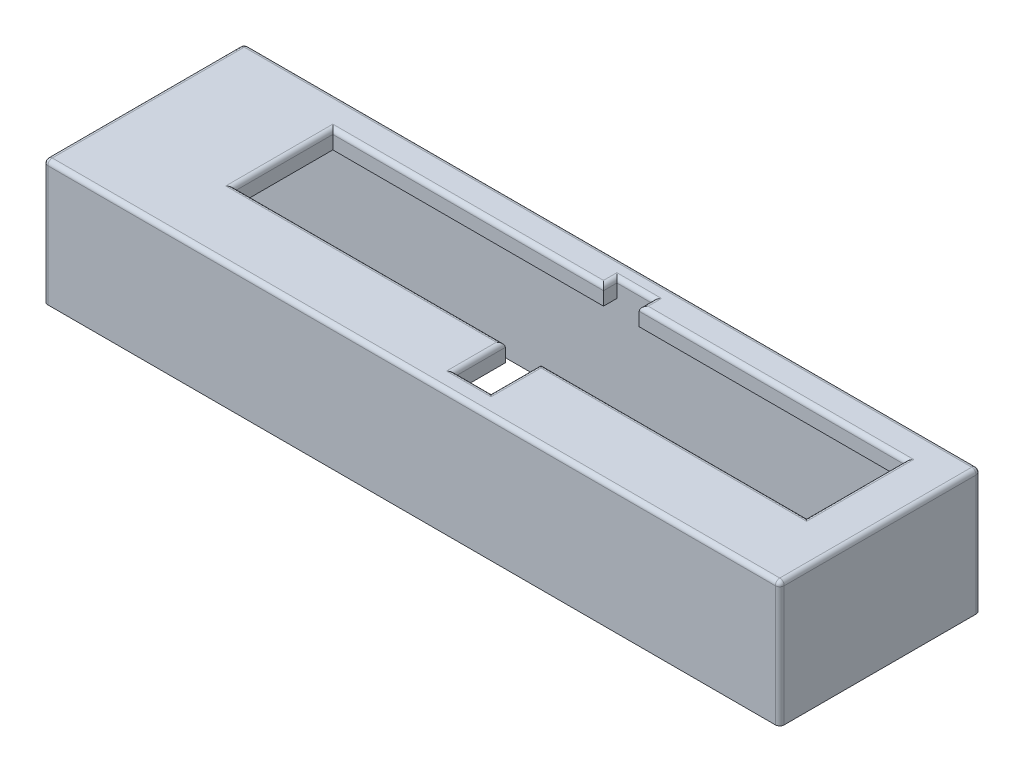
from build123d import *

# Parameters (mm, degrees)
SKETCH1_W           = 209.55
SKETCH1_H           = 57.15
BOSS_EXTRUDE1_DEPTH = 5.08
SKETCH2_W           = 209.55
SKETCH2_H           = 57.15
SKETCH2_W_2         = 199.39
SKETCH2_H_2         = 46.99
BOSS_EXTRUDE2_DEPTH = 30.48
CUT_EXTRUDE2_REACH  = 117.837
FILLET1_R           = 1.27


with BuildPart() as part:
    # Sketch1 → Boss-Extrude1 (new body)
    with BuildSketch(Plane(origin=(0, 0, 0), x_dir=(1, 0, 0), z_dir=(0, 1, 0))):
        with Locations((0, -5.715)):
            Rectangle(SKETCH1_W, SKETCH1_H)
    extrude(amount=BOSS_EXTRUDE1_DEPTH)

    # Sketch2 → Boss-Extrude2 (add)
    with BuildSketch(Plane.XZ):
        with Locations((0, 5.715)):
            Rectangle(SKETCH2_W, SKETCH2_H)
        with Locations((0, 5.715)):
            Rectangle(SKETCH2_W_2, SKETCH2_H_2, mode=Mode.SUBTRACT)
    extrude(amount=BOSS_EXTRUDE2_DEPTH)

    # Sketch3 → Cut-Extrude2 (cut, up to next)
    with BuildSketch(Plane(origin=(0, 5.08, 0), x_dir=(1, 0, 0), z_dir=(0, 1, 0)), mode=Mode.PRIVATE) as cut_extrude2_sk1:
        Polygon((6.35, 13.97), (-70.668502474, 13.97), (-70.668502474, -13.97), (6.35, -13.97), (6.35, -28.17903858), (16.51, -28.17903858), (16.51, -13.97), (92.086948761, -13.97), (92.086948761, 13.97), (16.51, 13.97), (16.51, 17.78), (6.35, 17.78), align=None)
    cut_extrude2_tool1 = extrude(cut_extrude2_sk1.sketch, amount=-CUT_EXTRUDE2_REACH, mode=Mode.PRIVATE) & part.part
    add(cut_extrude2_tool1.solids().sort_by_distance((10.737118, 5.08, 0.513245))[0], mode=Mode.SUBTRACT)

    # Fillet1
    fillet1_edges = [part.edges().sort_by_distance(p)[0] for p in [
        (0, 5.08, 34.29),
        (-104.775, 5.08, 5.715),
        (0, 5.08, -22.86),
        (104.775, 5.08, 5.715),
        (11.43, 5.08, 28.17903858),
        (16.51, 5.08, 21.07451929),
        (54.29847438, 5.08, 13.97),
        (92.086948761, 5.08, 0),
        (54.29847438, 5.08, -13.97),
        (16.51, 5.08, -15.875),
        (11.43, 5.08, -17.78),
        (6.35, 5.08, -15.875),
        (-32.159251237, 5.08, -13.97),
        (-70.668502474, 5.08, 0),
        (-32.159251237, 5.08, 13.97),
        (6.35, 5.08, 21.07451929),
        (104.775, -12.7, 34.29),
        (104.775, -12.7, -22.86),
        (-104.775, -12.7, 34.29),
        (-104.775, -12.7, -22.86),
    ]]
    fillet(fillet1_edges, radius=FILLET1_R)


solid = part.part
